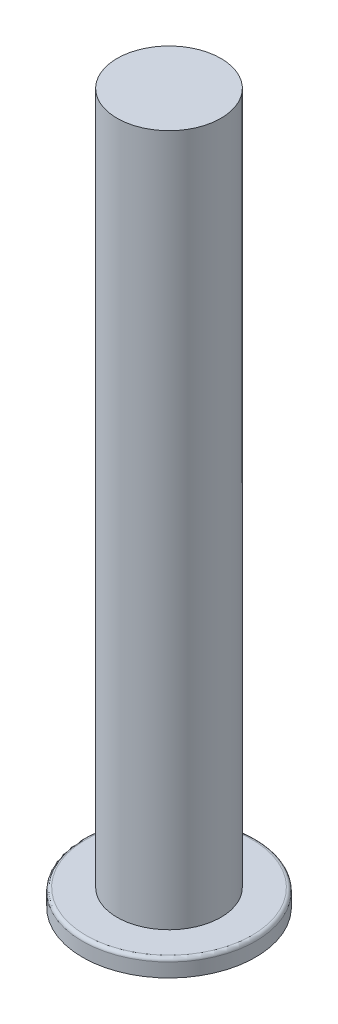
from build123d import *

# Parameters (mm, degrees)
FILLET2_R = 1


with BuildPart() as part:
    # Sketch1 → Revolve1 (revolve)
    with BuildSketch(Plane.XY):
        Polygon((0, 0), (0, 200), (15, 200), (15, 0), (25, 0), (25, -5), (0, -5), align=None)
    revolve(axis=Axis((0, 0, 0), (0, 1, 0)))

    # Fillet2
    fillet2_edges = [part.edges().sort_by_distance(p)[0] for p in [
        (-25, 0, 0),
    ]]
    fillet(fillet2_edges, radius=FILLET2_R)


solid = part.part
